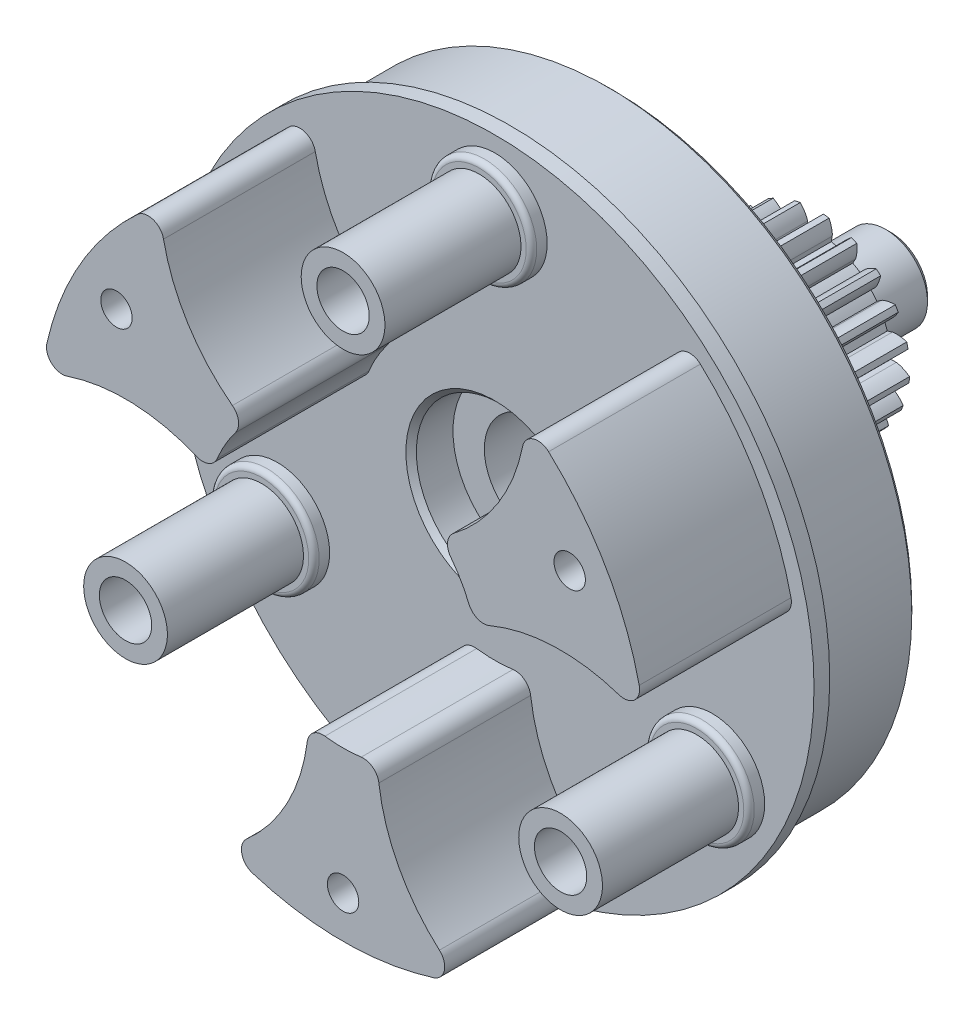
from build123d import *

# Parameters (mm, degrees)
SKETCH1_R                = 29
SKETCH1_R_2              = 2.5
BOSS_EXTRUDE1_DEPTH      = 11.34
SKETCH2_R                = 4
SKETCH2_R_2              = 2.5
BOSS_EXTRUDE2_DEPTH      = 14.5
SKETCH3_R                = 5
SKETCH3_R_2              = 4
BOSS_EXTRUDE3_DEPTH      = 1.5
BOSS_EXTRUDE4_DEPTH      = 14.5
FILLET2_R                = 0.5
FILLET5_R                = 1.5
CIRPATTERN1_COUNT        = 3
FILLET2_OF_CIRPATTERN1_R = 0.5
FILLET5_OF_CIRPATTERN1_R = 1.5
SKETCH5_R                = 1.5
CUT_EXTRUDE1_DEPTH       = 49.473761975
SKETCH6_R                = 2.75
CUT_EXTRUDE2_DEPTH       = 3
SKETCH7_R                = 4.25
CUT_EXTRUDE3_DEPTH       = 5
CIRPATTERN2_COUNT        = 3
CHAMFER1_SIZE            = 0.5
SKETCH9_R                = 8
CUT_EXTRUDE4_DEPTH       = 44.5
BOSS_EXTRUDE7_START      = -7.34
SKETCH10_R               = 8
SKETCH10_R_2             = 5
BOSS_EXTRUDE7_DEPTH      = 7.34
CHAMFER2_SIZE            = 0.5
BOSS_EXTRUDE8_START      = -1.5
SKETCH11_R               = 30.5
SKETCH11_R_2             = 29
BOSS_EXTRUDE8_DEPTH      = 1.5
SKETCH14_R               = 8.8
BOSS_EXTRUDE9_DEPTH      = 19.5
CUT_EXTRUDE7_START       = -19.5
CUT_EXTRUDE7_DEPTH       = 19.5
CIRPATTERN4_COUNT        = 20
SKETCH19_R               = 2.5
CUT_EXTRUDE8_DEPTH       = 51.281264901
SKETCH20_R               = 4.25
CUT_EXTRUDE9_DEPTH       = 6
SKETCH19_2_R             = 2.5
CUT_EXTRUDE10_DEPTH      = 51.623611092
CHAMFER3_SIZE            = 0.5
CHAMFER4_SIZE            = 0.75


with BuildPart() as part:
    # Sketch1 → Boss-Extrude1 (new body)
    with BuildSketch(Plane.XY):
        with Locations(Location((0, 0, 0), (0, 0, 180))):
            Circle(SKETCH1_R)
        with Locations(Location((0, 24, 0), (0, 0, 180))):
            Circle(SKETCH1_R_2, mode=Mode.SUBTRACT)
        with Locations(Location((20.784609691, -12, 0), (0, 0, 180))):
            Circle(SKETCH1_R_2, mode=Mode.SUBTRACT)
        with Locations(Location((-20.784609691, -12, 0), (0, 0, 180))):
            Circle(SKETCH1_R_2, mode=Mode.SUBTRACT)
    extrude(amount=BOSS_EXTRUDE1_DEPTH)

    # Sketch2 → Boss-Extrude2 (add)
    with BuildSketch(Plane.XY.offset(11.34)):
        with Locations(Location((0, 24, 0), (0, 0, 180))):
            Circle(SKETCH2_R)
        with Locations(Location((0, 24, 0), (0, 0, 180))):
            Circle(SKETCH2_R_2, mode=Mode.SUBTRACT)
    boss_extrude2 = extrude(amount=BOSS_EXTRUDE2_DEPTH)

    # Sketch3 → Boss-Extrude3 (add)
    with BuildSketch(Plane.XY.offset(11.34)):
        with Locations(Location((0, 24, 0), (0, 0, 90))):
            Circle(SKETCH3_R)
        with Locations(Location((0, 24, 0), (0, 0, 180))):
            Circle(SKETCH3_R_2, mode=Mode.SUBTRACT)
    boss_extrude3 = extrude(amount=BOSS_EXTRUDE3_DEPTH)

    # Sketch4 → Boss-Extrude4 (add)
    with BuildSketch(Plane.XY.offset(11.34)):
        with BuildLine():
            ThreePointArc((-9.243861456, 9.140625), (-15.08397544, 15.127363136), (-17.478886538, 23.140625))
            ThreePointArc((-17.478886538, 23.140625), (-25.11473671, 14.5), (-28.779812378, 3.566847272))
            ThreePointArc((-28.779812378, 3.566847272), (-20.642668488, 5.499424353), (-12.537944184, 3.43510635))
            ThreePointArc((-12.537944184, 3.43510635), (-11.258330249, 6.5), (-9.243861456, 9.140625))
        make_face()
    boss_extrude4 = extrude(amount=BOSS_EXTRUDE4_DEPTH)

    # Fillet2
    fillet2_edges = [part.edges().sort_by_distance(p)[0] for p in [
        (0, 19, 12.84),
    ]]
    fillet(fillet2_edges, radius=FILLET2_R)

    # Fillet5
    # the kernel refuses this fillet: 1.5 mm, written as the material it takes off along each edge
    with BuildSketch(Plane(origin=(-17.478886538, 23.140625, 11.34), x_dir=(0.12399934101480344, -0.9922823002693812, 0), z_dir=(0, 0, 1))) as fillet5_piece_1:
        with BuildLine():
            CenterArc((2.741938005, -1.495761572), FILLET5_R, 94.30820856, 121.194344996)
            ThreePointArc((1.52080355, -2.36687043), (0.731683032, -1.201888091), (0, 0))
            ThreePointArc((0, 0), (1.314627811, -0.049448326), (2.629255621, 0))
        make_face()
    extrude(amount=21.53336649, mode=Mode.SUBTRACT)
    with BuildSketch(Plane(origin=(-28.779812378, 3.566847272, 11.34), x_dir=(0.9213413502663426, 0.3887545707633453, 0), z_dir=(0, 0, 1))) as fillet5_piece_2:
        with BuildLine():
            CenterArc((2.741938005, 1.495761572), FILLET5_R, 144.497446444, 121.194344996)
            ThreePointArc((1.52080355, 2.36687043), (0.731683032, 1.201888091), (0, 0))
            ThreePointArc((0, 0), (1.314627811, 0.049448326), (2.629255621, 0))
        make_face()
    extrude(amount=21.53336649, mode=Mode.SUBTRACT)
    with BuildSketch(Plane(origin=(-12.537944184, 3.43510635, 11.34), x_dir=(-0.9027827871570022, 0.430096778891722, 0), z_dir=(0, 0, 1))) as fillet5_piece_3:
        with BuildLine():
            CenterArc((1.681832709, -1.498406794), FILLET5_R, 92.640987591, 90.493935252)
            ThreePointArc((0.184077424, -1.580437939), (0.116240905, -0.787400081), (0, 0))
            ThreePointArc((0, 0), (0.806358148, -0.018587399), (1.612716296, 0))
        make_face()
    extrude(amount=18.53179074, mode=Mode.SUBTRACT)
    with BuildSketch(Plane(origin=(-9.243861456, 9.140625, 11.34), x_dir=(-0.6582920213979585, -0.7527626548679136, 0), z_dir=(0, 0, 1))) as fillet5_piece_4:
        with BuildLine():
            CenterArc((1.682917286, -1.497188561), FILLET5_R, 93.508521646, 90.493935252)
            ThreePointArc((0.186575699, -1.601887437), (0.11175044, -0.798793336), (0, 0))
            ThreePointArc((0, 0), (0.795560899, -0.024365801), (1.591121798, 0))
        make_face()
    extrude(amount=18.53179074, mode=Mode.SUBTRACT)

    # CirPattern1: Boss-Extrude2, Boss-Extrude3, Boss-Extrude4 ×3 about axis
    cirpattern1_axis = Axis((0, 0, 0), (0, 0, 1))
    add([boss_extrude2.rotate(cirpattern1_axis, i * 360 / CIRPATTERN1_COUNT) for i in range(1, CIRPATTERN1_COUNT)])
    add([boss_extrude3.rotate(cirpattern1_axis, i * 360 / CIRPATTERN1_COUNT) for i in range(1, CIRPATTERN1_COUNT)])
    add([boss_extrude4.rotate(cirpattern1_axis, i * 360 / CIRPATTERN1_COUNT) for i in range(1, CIRPATTERN1_COUNT)])

    # Fillet2 of CirPattern1
    fillet2_of_cirpattern1_edges = [part.edges().sort_by_distance(p)[0] for p in [
        (-16.454482672, -9.5, 12.84),
        (16.454482672, -9.5, 12.84),
    ]]
    fillet(fillet2_of_cirpattern1_edges, radius=FILLET2_OF_CIRPATTERN1_R)

    # Fillet5 of CirPattern1
    # the kernel refuses this fillet: 1.5 mm, written as the material it takes off along each edge
    with BuildSketch(Plane(origin=(-11.30092584, -26.707472272, 11.34), x_dir=(0.9387654185354608, -0.3445569458913013, 0), z_dir=(0, 0, 1))) as fillet5_of_cirpattern1_piece_1:
        with BuildLine():
            CenterArc((2.740587632, 1.498234339), FILLET5_OF_CIRPATTERN1_R, 151.58593368, 121.194344996)
            ThreePointArc((1.421289964, 2.211994566), (0.752245893, 1.079267128), (0, 0))
            ThreePointArc((0, 0), (1.406673298, -0.034136121), (2.813346596, 0))
        make_face()
    extrude(amount=21.53336649, mode=Mode.SUBTRACT)
    with BuildSketch(Plane(origin=(11.30092584, -26.707472272, 11.34), x_dir=(-0.9387654185354388, -0.3445569458913611, 0), z_dir=(0, 0, 1))) as fillet5_of_cirpattern1_piece_2:
        with BuildLine():
            CenterArc((2.740587632, -1.498234339), FILLET5_OF_CIRPATTERN1_R, 87.219721325, 121.194344996)
            ThreePointArc((1.421289964, -2.211994566), (0.752245893, -1.079267128), (0, 0))
            ThreePointArc((0, 0), (1.406673298, 0.034136121), (2.813346596, 0))
        make_face()
    extrude(amount=21.53336649, mode=Mode.SUBTRACT)
    with BuildSketch(Plane(origin=(3.294082729, -12.57573135, 11.34), x_dir=(0.07891665697240977, -0.9968812172231449, 0), z_dir=(0, 0, 1)), Plane(origin=(9.243861456, 9.140625, 11.34), x_dir=(0.8238661301845911, 0.5667844383314227, 0), z_dir=(0, 0, 1))) as fillet5_of_cirpattern1_piece_3:
        with BuildLine():
            CenterArc((1.681832709, -1.498406794), FILLET5_OF_CIRPATTERN1_R, 92.640987591, 90.493935252)
            ThreePointArc((0.184077424, -1.580437939), (0.116240905, -0.787400081), (0, 0))
            ThreePointArc((0, 0), (0.806358148, -0.018587399), (1.612716296, 0))
        make_face()
    extrude(amount=18.53179074, mode=Mode.SUBTRACT)
    with BuildSketch(Plane(origin=(-3.294082729, -12.57573135, 11.34), x_dir=(0.9810575928348104, -0.19371628620528378, 0), z_dir=(0, 0, 1)), Plane(origin=(12.537944184, 3.43510635, 11.34), x_dir=(-0.3227655714368499, 0.9464789410731987, 0), z_dir=(0, 0, 1))) as fillet5_of_cirpattern1_piece_4:
        with BuildLine():
            CenterArc((1.682917286, -1.497188561), FILLET5_OF_CIRPATTERN1_R, 93.508521646, 90.493935252)
            ThreePointArc((0.186575699, -1.601887437), (0.11175044, -0.798793336), (0, 0))
            ThreePointArc((0, 0), (0.795560899, -0.024365801), (1.591121798, 0))
        make_face()
    extrude(amount=18.53179074, mode=Mode.SUBTRACT)
    with BuildSketch(Plane(origin=(28.779812378, 3.566847272, 11.34), x_dir=(-0.9213413502663421, 0.3887545707633462, 0), z_dir=(0, 0, 1))) as fillet5_of_cirpattern1_piece_5:
        with BuildLine():
            CenterArc((2.741938005, -1.495761572), FILLET5_OF_CIRPATTERN1_R, 94.30820856, 121.194344996)
            ThreePointArc((1.52080355, -2.36687043), (0.731683032, -1.201888091), (0, 0))
            ThreePointArc((0, 0), (1.314627811, -0.049448326), (2.629255621, 0))
        make_face()
    extrude(amount=21.53336649, mode=Mode.SUBTRACT)
    with BuildSketch(Plane(origin=(17.478886538, 23.140625, 11.34), x_dir=(-0.1239993410147923, -0.9922823002693827, 0), z_dir=(0, 0, 1))) as fillet5_of_cirpattern1_piece_6:
        with BuildLine():
            CenterArc((2.741938005, 1.495761572), FILLET5_OF_CIRPATTERN1_R, 144.497446444, 121.194344996)
            ThreePointArc((1.52080355, 2.36687043), (0.731683032, 1.201888091), (0, 0))
            ThreePointArc((0, 0), (1.314627811, 0.049448326), (2.629255621, 0))
        make_face()
    extrude(amount=21.53336649, mode=Mode.SUBTRACT)

    # Sketch5 → Cut-Extrude1 (cut, through all)
    with BuildSketch(Plane.XY.offset(25.84)):
        with Locations((-21.650635095, 12.5)):
            Circle(SKETCH5_R)
    cut_extrude1 = extrude(amount=-CUT_EXTRUDE1_DEPTH, mode=Mode.SUBTRACT)

    # Sketch6 → Cut-Extrude2 (cut)
    with BuildSketch(Plane(origin=(0, 0, 0), x_dir=(-1, 0, 0), z_dir=(0, 0, -1))):
        with Locations((21.650635095, 12.5)):
            Circle(SKETCH6_R)
    cut_extrude2 = extrude(amount=-CUT_EXTRUDE2_DEPTH, mode=Mode.SUBTRACT)

    # Sketch7 → Cut-Extrude3 (cut)
    with BuildSketch(Plane(origin=(0, 0, 0), x_dir=(-1, 0, 0), z_dir=(0, 0, -1))):
        with Locations((0, 24)):
            Circle(SKETCH7_R)
    cut_extrude3 = extrude(amount=-CUT_EXTRUDE3_DEPTH, mode=Mode.SUBTRACT)

    # CirPattern2: Cut-Extrude1, Cut-Extrude2, Cut-Extrude3 ×3 about axis
    cirpattern2_axis = Axis((0, 0, 0), (0, 0, 1))
    add([cut_extrude1.rotate(cirpattern2_axis, i * 360 / CIRPATTERN2_COUNT) for i in range(1, CIRPATTERN2_COUNT)], mode=Mode.SUBTRACT)
    add([cut_extrude2.rotate(cirpattern2_axis, i * 360 / CIRPATTERN2_COUNT) for i in range(1, CIRPATTERN2_COUNT)], mode=Mode.SUBTRACT)
    add([cut_extrude3.rotate(cirpattern2_axis, i * 360 / CIRPATTERN2_COUNT) for i in range(1, CIRPATTERN2_COUNT)], mode=Mode.SUBTRACT)

    # Chamfer1
    chamfer1_edges = [part.edges().sort_by_distance(p)[0] for p in [
        (29, 0, 0),
    ]]
    chamfer(chamfer1_edges, length=CHAMFER1_SIZE)

    # Sketch9 → Cut-Extrude4 (cut, through all)
    with BuildSketch(Plane.XY.offset(11.34)):
        Circle(SKETCH9_R)
    extrude(amount=-CUT_EXTRUDE4_DEPTH, mode=Mode.SUBTRACT)

    # Sketch10 → Boss-Extrude7 (add)
    with BuildSketch(Plane(origin=(0, 0, 0), x_dir=(-1, 0, 0), z_dir=(0, 0, -1)).offset(BOSS_EXTRUDE7_START)):
        with Locations(Location((0, 0, 0), (0, 0, 180))):
            Circle(SKETCH10_R)
        Circle(SKETCH10_R_2, mode=Mode.SUBTRACT)
    extrude(amount=BOSS_EXTRUDE7_DEPTH)

    # Chamfer2
    chamfer2_edges = [part.edges().sort_by_distance(p)[0] for p in [
        (-8, 0, 11.34),
    ]]
    chamfer(chamfer2_edges, length=CHAMFER2_SIZE)

    # Sketch11 → Boss-Extrude8 (add)
    with BuildSketch(Plane.XY.offset(11.34).offset(BOSS_EXTRUDE8_START)):
        Circle(SKETCH11_R)
        with Locations(Location((0, 0, 0), (0, 0, 180))):
            Circle(SKETCH11_R_2, mode=Mode.SUBTRACT)
    extrude(amount=BOSS_EXTRUDE8_DEPTH)

    # Sketch14 → Boss-Extrude9 (add)
    with BuildSketch(Plane(origin=(0, 0, 0), x_dir=(-1, 0, 0), z_dir=(0, 0, -1))):
        with Locations(Location((0, 0, 0), (0, 0, 180))):
            Circle(SKETCH14_R)
    extrude(amount=BOSS_EXTRUDE9_DEPTH)

    # Sketch18 → Cut-Extrude7 (cut)
    with BuildSketch(Plane(origin=(0, 0, -19.5), x_dir=(-1, 0, 0), z_dir=(0, 0, -1)).offset(CUT_EXTRUDE7_START)):
        with BuildLine():
            add(Edge.make_bspline(
                [(7.517540966, 0), (7.520110867, 3.6973e-05), (7.527316988, 0.000255168), (7.549556806, 0.001667623), (7.593331739, 0.006531197), (7.647158848, 0.015511709), (7.708756635, 0.028671013), (7.767907562, 0.043594547), (7.818276462, 0.057728746), (7.868310582, 0.073103278), (7.917948492, 0.089566042), (7.977812879, 0.110857746), (8.049216208, 0.138262229), (8.132064496, 0.17300617), (8.225261452, 0.215599502), (8.319346878, 0.262389143), (8.411162907, 0.31119897), (8.502976335, 0.363665246), (8.591128995, 0.416660078), (8.674672151, 0.470416277), (8.731059451, 0.507888891), (8.767993641, 0.533390395), (8.783169443, 0.543998654)],
                knots=[0, 0, 0, 0, 0, 0.005376749, 0.015083688, 0.04661014, 0.092110525, 0.119476176, 0.146842496, 0.174208854, 0.201574956, 0.228941013, 0.256307345, 0.307035032, 0.361767352, 0.416499661, 0.471231937, 0.525964282, 0.580696616, 0.635428982, 0.690161387, 0.728074997, 0.728074997, 0.728074997, 0.728074997, 0.728074997], degree=4))
            Line((7.517540966, 0), (7, 0))
            ThreePointArc((7, 0), (6.985831643, -0.44514745), (6.943383928, -0.888492898))
            Line((6.943383928, -0.888492898), (7.456739017, -0.954183109))
            add(Edge.make_bspline(
                [(7.456739017, -0.954183109), (7.45928344, -0.954545974), (7.466403583, -0.95567706), (7.488284246, -0.959900936), (7.531087805, -0.970281418), (7.583339685, -0.98602144), (7.642768991, -1.006892768), (7.699547296, -1.029203483), (7.747714793, -1.049616566), (7.795392784, -1.071217457), (7.842539644, -1.093847489), (7.899217343, -1.122565426), (7.966564777, -1.158811311), (8.044333024, -1.203789973), (8.131369934, -1.257868072), (8.218755502, -1.316221311), (8.30363361, -1.376290348), (8.388045034, -1.43998593), (8.46875821, -1.503741141), (8.544802524, -1.567666489), (8.595977456, -1.611993126), (8.629376078, -1.64197634), (8.643082658, -1.654425026)],
                knots=[0, 0, 0, 0, 0, 0.005376749, 0.015083688, 0.04661014, 0.092110525, 0.119476176, 0.146842496, 0.174208854, 0.201574956, 0.228941013, 0.256307345, 0.307035032, 0.361767352, 0.416499661, 0.471231937, 0.525964282, 0.580696616, 0.635428982, 0.690161387, 0.728074997, 0.728074997, 0.728074997, 0.728074997, 0.728074997], degree=4))
            ThreePointArc((8.643082658, -1.654425026), (8.760682833, -0.830924969), (8.8, 0))
            ThreePointArc((8.8, 0), (8.795791354, 0.272129474), (8.783169443, 0.543998654))
        make_face()
    cut_extrude7 = extrude(amount=CUT_EXTRUDE7_DEPTH, mode=Mode.SUBTRACT)

    # CirPattern4: Cut-Extrude7 ×20 about axis
    cirpattern4_axis = Axis((0, 0, -19.5), (0, 0, 1))
    for i in range(1, CIRPATTERN4_COUNT):
        add(cut_extrude7.rotate(cirpattern4_axis, i * 360 / CIRPATTERN4_COUNT), mode=Mode.SUBTRACT)

    # Sketch19 → Cut-Extrude8 (cut, through all)
    with BuildSketch(Plane.XY):
        Circle(SKETCH19_R)
    extrude(amount=-CUT_EXTRUDE8_DEPTH, mode=Mode.SUBTRACT)

    # Sketch20 → Cut-Extrude9 (cut)
    with BuildSketch(Plane.XY):
        Circle(SKETCH20_R)
    extrude(amount=-CUT_EXTRUDE9_DEPTH, mode=Mode.SUBTRACT)

    # Sketch22 → Revolve1 (revolve)
    with BuildSketch(Plane(origin=(0, 0, 0), x_dir=(1, 0, 0), z_dir=(0, 1, 0))):
        Polygon((0, 26.5), (4, 26.5), (4, 21), (4.5, 21), (4.5, 19.5), (0, 19.5), align=None)
    revolve(axis=Axis((0, 0, 0), (0, 0, -1)))

    # Sketch19<2> → Cut-Extrude10 (cut, through all)
    with BuildSketch(Plane.XY):
        Circle(SKETCH19_2_R)
    extrude(amount=-CUT_EXTRUDE10_DEPTH, mode=Mode.SUBTRACT)

    # Chamfer3
    chamfer3_edges = [part.edges().sort_by_distance(p)[0] for p in [
        (-4, 0, -26.5),
    ]]
    chamfer(chamfer3_edges, length=CHAMFER3_SIZE)

    # Chamfer4
    chamfer4_edges = [part.edges().sort_by_distance(p)[0] for p in [
        (-4.5, 0, -19.5),
    ]]
    chamfer(chamfer4_edges, length=CHAMFER4_SIZE)


solid = part.part
